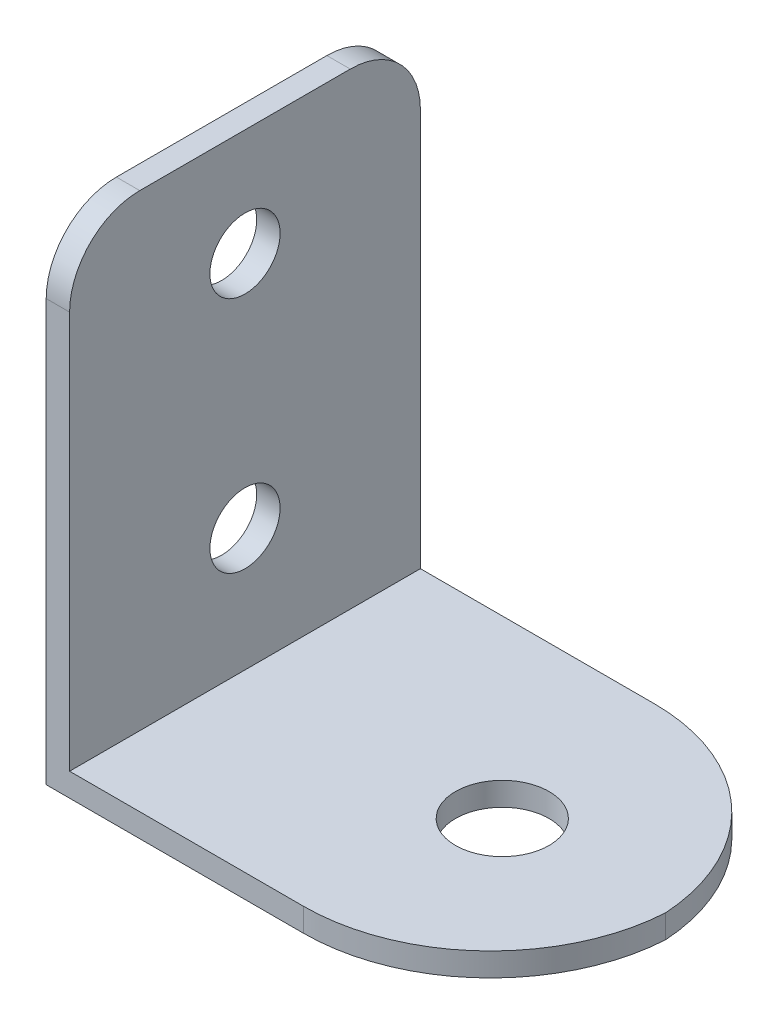
from build123d import *

# Parameters (mm, degrees)
EXTRUDE_THIN1_DEPTH = 15
FILLET1_R           = 8
SKETCH2_R           = 1.5
CUT_EXTRUDE1_DEPTH  = 32.391175729
FILLET2_R           = 3
SKETCH3_R           = 2
CUT_EXTRUDE2_DEPTH  = 31.796707523


with BuildPart() as part:
    # Sketch1 → Extrude-Thin1 (new body)
    with BuildSketch(Plane.XY):
        Polygon((18, 0), (0, 0), (0, 20), (-1, 20), (-1, -1), (18, -1), align=None)
    extrude(amount=EXTRUDE_THIN1_DEPTH)

    # Fillet1
    # the kernel refuses this fillet: 8 mm, written as the material it takes off along each edge
    with BuildSketch(Plane(origin=(18, -21, 0), x_dir=(0, 0, 1), z_dir=(0, 1, 0))) as fillet1_piece_1:
        with BuildLine():
            CenterArc((FILLET1_R, -FILLET1_R), FILLET1_R, 90, 90)
            Line((0, -FILLET1_R), (0, 0))
            Line((0, 0), (FILLET1_R, 0))
        make_face()
    extrude(amount=41, mode=Mode.SUBTRACT)
    with BuildSketch(Plane(origin=(18, -21, 15), x_dir=(0, 0, -1), z_dir=(0, 1, 0))) as fillet1_piece_2:
        with BuildLine():
            CenterArc((FILLET1_R, FILLET1_R), FILLET1_R, 180, 90)
            Line((0, FILLET1_R), (0, 0))
            Line((0, 0), (FILLET1_R, 0))
        make_face()
    extrude(amount=41, mode=Mode.SUBTRACT)

    # Sketch2 → Cut-Extrude1 (cut, through all)
    with BuildSketch(Plane.ZY.offset(1)):
        with Locations((7.5, 5.247627846)):
            Circle(SKETCH2_R)
        with Locations((7.5, 15.420132795)):
            Circle(SKETCH2_R)
    extrude(amount=-CUT_EXTRUDE1_DEPTH, mode=Mode.SUBTRACT)

    # Fillet2
    fillet2_edges = [part.edges().sort_by_distance(p)[0] for p in [
        (-0.5, 20, 15),
        (-0.5, 20, 0),
    ]]
    fillet(fillet2_edges, radius=FILLET2_R)

    # Sketch3 → Cut-Extrude2 (cut, through all)
    with BuildSketch(Plane(origin=(0, 0, 0), x_dir=(1, 0, 0), z_dir=(0, 1, 0))):
        with Locations(Location((11, -7.5, 0), (0, 0, 270))):
            Circle(SKETCH3_R)
    extrude(amount=-CUT_EXTRUDE2_DEPTH, mode=Mode.SUBTRACT)


solid = part.part
